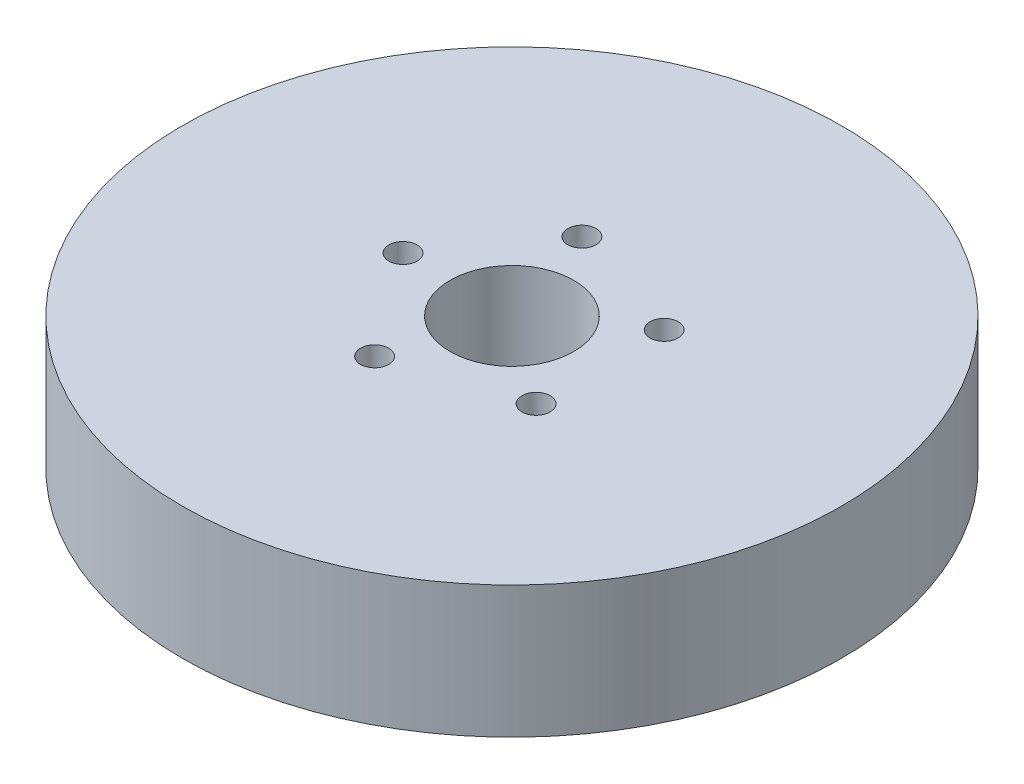
from build123d import *

# Parameters (mm, degrees)
SKETCH1_R           = 40
BOSS_EXTRUDE1_DEPTH = 16
SKETCH2_R           = 7.5
CUT_EXTRUDE1_DEPTH  = 59.787753827
SKETCH3_R           = 1.710921045
CUT_EXTRUDE2_DEPTH  = 10.815100178
CIRPATTERN1_COUNT   = 5


with BuildPart() as part:
    # Sketch1 → Boss-Extrude1 (new body)
    with BuildSketch(Plane(origin=(0, 0, 0), x_dir=(1, 0, 0), z_dir=(0, 1, 0))):
        Circle(SKETCH1_R)
    extrude(amount=BOSS_EXTRUDE1_DEPTH)

    # Sketch2 → Cut-Extrude1 (cut, through all)
    with BuildSketch(Plane(origin=(0, 0, 0), x_dir=(1, 0, 0), z_dir=(0, 1, 0))):
        Circle(SKETCH2_R)
    extrude(amount=CUT_EXTRUDE1_DEPTH, mode=Mode.SUBTRACT)

    # Sketch3 → Cut-Extrude2 (cut)
    with BuildSketch(Plane(origin=(0, 16, 0), x_dir=(1, 0, 0), z_dir=(0, 1, 0))):
        with Locations((-13.22627292, 0)):
            Circle(SKETCH3_R)
    cut_extrude2 = extrude(amount=-CUT_EXTRUDE2_DEPTH, mode=Mode.SUBTRACT)

    # CirPattern1: Cut-Extrude2 ×5 about axis
    cirpattern1_axis = Axis((0, 0, 0), (0, 1, 0))
    for i in range(1, CIRPATTERN1_COUNT):
        add(cut_extrude2.rotate(cirpattern1_axis, i * 360 / CIRPATTERN1_COUNT), mode=Mode.SUBTRACT)


solid = part.part
